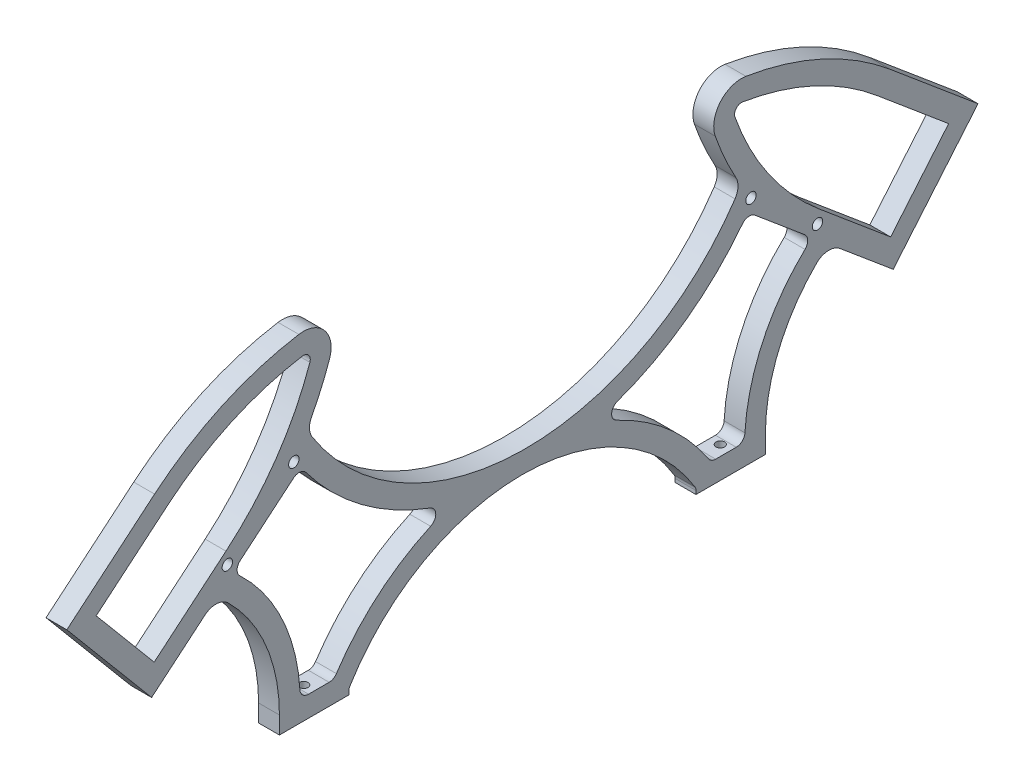
from build123d import *

# Parameters (mm, degrees)
SKETCH1_R                   = 1.5
BOSS_EXTRUDE1_DEPTH         = 6
TAP_DRILL_FOR_M3_TAP1_D     = 2.5
TAP_DRILL_FOR_M3_TAP1_DEPTH = 10
TAP_DRILL_FOR_M3_TAP1_TIP   = 0.751075774
FILLET1_R                   = 2.5


with BuildPart() as part:
    # Sketch1 → Boss-Extrude1 (new body)
    with BuildSketch(Plane(origin=(0, 0, 0), x_dir=(0, 0, -1), z_dir=(1, 0, 0))):
        with BuildLine():
            Line((0, 0), (0, 5))
            ThreePointArc((0, 5), (-3.840871797, 24.159286169), (-14.769907871, 40.357641429))
            ThreePointArc((-14.769907871, 40.357641429), (-18.081061634, 41.796853013), (-21.498126045, 40.631202964))
            Line((-21.498126045, 40.631202964), (-36.819014908, 27.77545077))
            Line((-36.819014908, 27.77545077), (-61.244944076, 56.885139609))
            Line((-61.244944076, 56.885139609), (-35.965477453, 78.097130729))
            ThreePointArc((-35.965477453, 78.097130729), (-16.466905963, 90.429272666), (5.603669203, 97.149817787))
            ThreePointArc((5.603669203, 97.149817787), (13.017620401, 94.396091574), (14.442092211, 86.616595416))
            ThreePointArc((14.442092211, 86.616595416), (12.063372013, 80.550781226), (9.233421636, 74.681897821))
            ThreePointArc((9.233421636, 74.681897821), (8.65601493, 72.138968867), (9.437468182, 69.651155171))
            ThreePointArc((9.437468182, 69.651155171), (69.938592339, 36.005621509), (131.25690807, 68.137725634))
            ThreePointArc((131.25690807, 68.137725634), (132.105731014, 70.711229175), (131.487302699, 73.349593684))
            ThreePointArc((131.487302699, 73.349593684), (128.242624394, 79.857963261), (125.557907789, 86.616595416))
            ThreePointArc((125.557907789, 86.616595416), (126.982379599, 94.396091574), (134.396330797, 97.149817787))
            ThreePointArc((134.396330797, 97.149817787), (156.466905963, 90.429272666), (175.965477453, 78.097130729))
            Line((175.965477453, 78.097130729), (201.244944076, 56.885139609))
            Line((201.244944076, 56.885139609), (176.819014908, 27.77545077))
            Line((176.819014908, 27.77545077), (161.498126045, 40.631202964))
            ThreePointArc((161.498126045, 40.631202964), (158.081061634, 41.796853013), (154.769907871, 40.357641429))
            ThreePointArc((154.769907871, 40.357641429), (143.840871797, 24.159286169), (140, 5))
            Line((140, 5), (140, 0))
            Line((140, 0), (120, 0))
            Line((120, 0), (120, 1))
            ThreePointArc((120, 1), (119.925928039, 1.539259851), (119.709198813, 2.038575668))
            ThreePointArc((119.709198813, 2.038575668), (70, 30), (20.290801187, 2.038575668))
            ThreePointArc((20.290801187, 2.038575668), (20.074071961, 1.539259851), (20, 1))
            Line((20, 1), (20, 0))
            Line((20, 0), (0, 0))
        make_face()
        with Locations((-15, 50)):
            Circle(SKETCH1_R, mode=Mode.SUBTRACT)
        with Locations((155, 50)):
            Circle(SKETCH1_R, mode=Mode.SUBTRACT)
        with Locations((4.151111078, 66.069690242)):
            Circle(SKETCH1_R, mode=Mode.SUBTRACT)
        with Locations((135.848888922, 66.069690242)):
            Circle(SKETCH1_R, mode=Mode.SUBTRACT)
        with BuildLine():
            Line((153.504098974, 47.338988131), (134.936055197, 62.919426816))
            ThreePointArc((134.936055197, 62.919426816), (115.501820953, 43.86520175), (90.747136382, 32.553325453))
            ThreePointArc((90.747136382, 32.553325453), (109.809667934, 22.15779508), (124.313902456, 6))
            Line((124.313902456, 6), (134.008976379, 6))
            ThreePointArc((134.008976379, 6), (139.32168697, 28.760932732), (153.504098974, 47.338988131))
        make_face(mode=Mode.SUBTRACT)
        with BuildLine():
            Line((6.123329525, 63.808356146), (-13.504098974, 47.338988131))
            ThreePointArc((-13.504098974, 47.338988131), (0.67831303, 28.760932732), (5.991023621, 6))
            Line((5.991023621, 6), (15.686097544, 6))
            ThreePointArc((15.686097544, 6), (30.50092083, 22.40193877), (50.002095819, 32.80418653))
            ThreePointArc((50.002095819, 32.80418653), (25.340644787, 44.453854645), (6.123329525, 63.808356146))
        make_face(mode=Mode.SUBTRACT)
        with BuildLine():
            Line((155.396273943, 53.583708549), (176.079473907, 36.228443087))
            Line((176.079473907, 36.228443087), (192.791951759, 56.145598608))
            Line((192.791951759, 56.145598608), (172.108751795, 73.50086407))
            ThreePointArc((172.108751795, 73.50086407), (153.966960187, 84.974891756), (133.432134057, 91.227797469))
            ThreePointArc((133.432134057, 91.227797469), (131.578646258, 90.539365916), (131.222528305, 88.594491876))
            ThreePointArc((131.222528305, 88.594491876), (140.946273467, 69.457441579), (155.396273943, 53.583708549))
        make_face(mode=Mode.SUBTRACT)
        with BuildLine():
            Line((-32.108751795, 73.50086407), (-52.791951759, 56.145598608))
            Line((-52.791951759, 56.145598608), (-36.079473907, 36.228443087))
            Line((-36.079473907, 36.228443087), (-15.396273943, 53.583708549))
            ThreePointArc((-15.396273943, 53.583708549), (-0.946273467, 69.457441579), (8.777471695, 88.594491876))
            ThreePointArc((8.777471695, 88.594491876), (8.421353742, 90.539365916), (6.567865943, 91.227797469))
            ThreePointArc((6.567865943, 91.227797469), (-13.966960187, 84.974891756), (-32.108751795, 73.50086407))
        make_face(mode=Mode.SUBTRACT)
    extrude(amount=BOSS_EXTRUDE1_DEPTH)

    # Tap Drill for M3 Tap1
    with Locations(Plane(origin=(0, 0, 0), x_dir=(-1, 0, 0), z_dir=(0, -1, 0))):
        with Locations((-3, 10), (-3, 130)):
            Hole(TAP_DRILL_FOR_M3_TAP1_D / 2, depth=TAP_DRILL_FOR_M3_TAP1_DEPTH)
            with Locations((0, 0, -(TAP_DRILL_FOR_M3_TAP1_DEPTH + TAP_DRILL_FOR_M3_TAP1_TIP / 2))):  # 118° drill point
                Cone(0, TAP_DRILL_FOR_M3_TAP1_D / 2, TAP_DRILL_FOR_M3_TAP1_TIP, mode=Mode.SUBTRACT)

    # Fillet1
    fillet1_edges = [part.edges().sort_by_distance(p)[0] for p in [
        (3, 6, -15.686097544),
        (3, 6, -5.991023621),
        (3, 47.338988131, 13.504098974),
        (3, 63.808356146, -6.123329525),
        (3, 47.338988131, -153.504098974),
        (3, 6, -134.008976379),
        (3, 62.919426816, -134.936055197),
        (3, 32.80418653, -50.002095819),
        (3, 6, -124.313902456),
        (3, 32.553325453, -90.747136382),
    ]]
    fillet(fillet1_edges, radius=FILLET1_R)


solid = part.part
